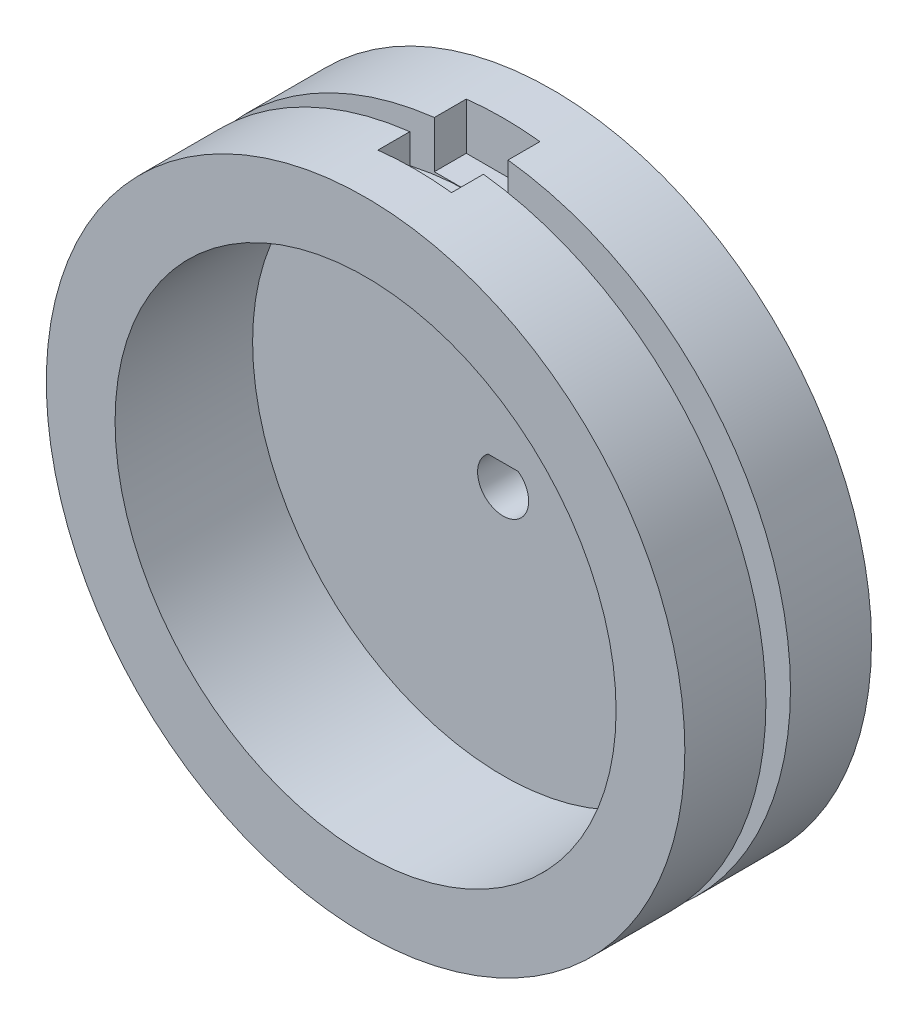
from build123d import *

# Parameters (mm, degrees)
SKETCH7_W          = 7.5
SKETCH7_H          = 9
CUT_EXTRUDE1_DEPTH = 5
CUT_EXTRUDE2_DEPTH = 50.734294003


with BuildPart() as part:
    # Sketch2 → Revolve1 (revolve)
    with BuildSketch(Plane(origin=(0, 0, 0), x_dir=(0, 0, -1), z_dir=(1, 0, 0))):
        Polygon((0, 0), (0, 32.5), (-8.25, 32.5), (-8.25, 27.5), (-10.75, 27.5), (-10.75, 32.5), (-19, 32.5), (-19, 25.5), (-5, 25.5), (-5, 0), align=None)
    revolve(axis=Axis((0, 0, 5), (0, 0, -1)))

    # Sketch7 → Cut-Extrude1 (cut)
    with BuildSketch(Plane(origin=(0, 32.5, 0), x_dir=(1, 0, 0), z_dir=(0, 1, 0))):
        with Locations((0, -9.5)):
            Rectangle(SKETCH7_W, SKETCH7_H)
    cut_extrude1 = extrude(amount=-CUT_EXTRUDE1_DEPTH, mode=Mode.SUBTRACT)

    # Mirror1: Cut-Extrude1 across plane
    add(cut_extrude1.mirror(Plane.ZX), mode=Mode.SUBTRACT)

    # Sketch8 → Cut-Extrude2 (cut, through all)
    with BuildSketch(Plane(origin=(0, 0, 0), x_dir=(-1, 0, 0), z_dir=(0, 0, -1))):
        with BuildLine():
            Line((-1.532970972, 2.1), (1.532970972, 2.1))
            ThreePointArc((1.532970972, 2.1), (0, -2.6), (-1.532970972, 2.1))
        make_face()
    extrude(amount=-CUT_EXTRUDE2_DEPTH, mode=Mode.SUBTRACT)


solid = part.part
